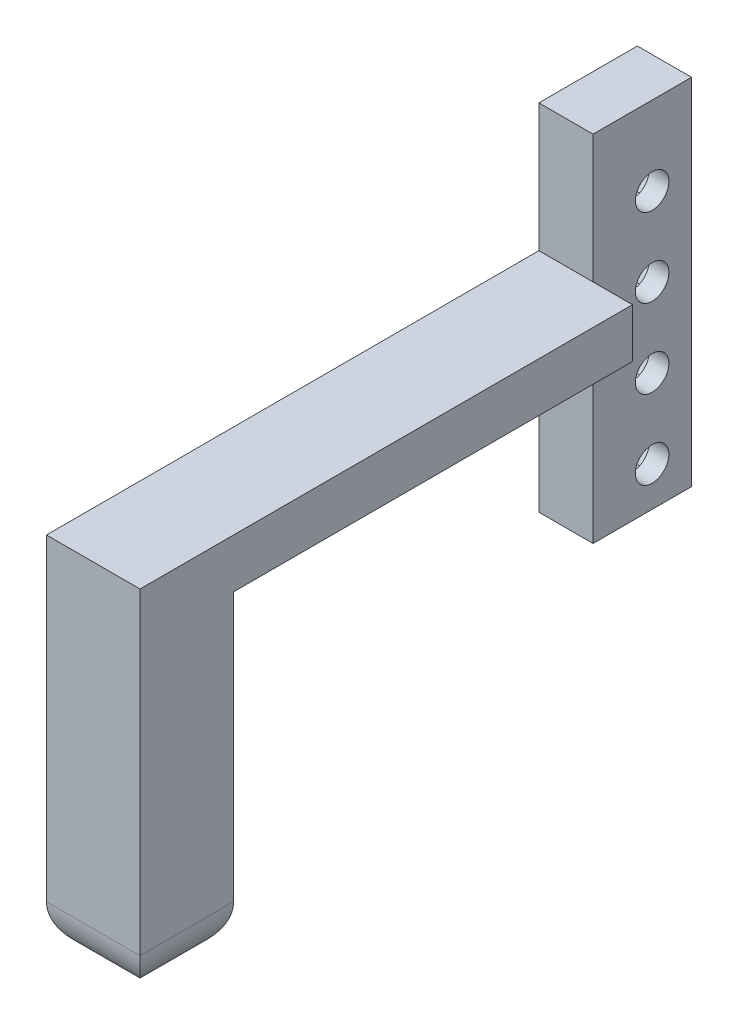
from build123d import *

# Parameters (mm, degrees)
ESQUISSE1_W                       = 5.5
ESQUISSE1_H                       = 36
BOSS_EXTRU_1_DEPTH                = 10
ESQUISSE2_R                       = 1.7
ENL_V_MAT_EXTRU_1_DEPTH           = 4
ENL_V_MAT_EXTRU_2_DEPTH           = 3.5
ENL_V_MAT_EXTRU_2_DRAFT           = 5
ENL_V_MAT_EXTRU_2_PROFILE_2_DEPTH = 3.5
ENL_V_MAT_EXTRU_2_PROFILE_2_DRAFT = 5
ENL_V_MAT_EXTRU_2_PROFILE_3_DEPTH = 3.5
ENL_V_MAT_EXTRU_2_PROFILE_3_DRAFT = 5
ENL_V_MAT_EXTRU_2_PROFILE_4_DEPTH = 3.5
ENL_V_MAT_EXTRU_2_PROFILE_4_DRAFT = 5
ESQUISSE4_W                       = 9.5
ESQUISSE4_H                       = 5
BOSS_EXTRU_2_DEPTH                = 50
ESQUISSE5_W                       = 9.5
ESQUISSE5_H                       = 9.5
BOSS_EXTRU_3_DEPTH                = 32
CONG_1_R                          = 4.75


with BuildPart() as part:
    # Esquisse1 → Boss.-Extru.1 (new body)
    with BuildSketch(Plane.XY):
        Rectangle(ESQUISSE1_W, ESQUISSE1_H)
    extrude(amount=BOSS_EXTRU_1_DEPTH)

    # Esquisse2 → Enlèv. mat.-Extru.1 (cut)
    with BuildSketch(Plane(origin=(2.75, 0, 0), x_dir=(0, 0, -1), z_dir=(1, 0, 0))):
        with Locations((-4, 10)):
            Circle(ESQUISSE2_R)
        with Locations((-4, 2)):
            Circle(ESQUISSE2_R)
        with Locations((-4, -6)):
            Circle(ESQUISSE2_R)
        with Locations((-4, -14)):
            Circle(ESQUISSE2_R)
    extrude(amount=-ENL_V_MAT_EXTRU_1_DEPTH, mode=Mode.SUBTRACT)


with BuildPart() as enl_v_mat_extru_2_tool:
    # Esquisse3 → Enlèv. mat.-Extru.2 (with draft: the straight prism first)
    with BuildSketch(Plane(origin=(-2.75, 0, 0), x_dir=(0, 0, -1), z_dir=(1, 0, 0))):
        Polygon((-2.574135551, 4.901765653), (-5.800070547, 4.685717662), (-7.225934996, 1.783952009), (-5.425864449, -0.901765653), (-2.199929453, -0.685717662), (-0.774065004, 2.216047991), align=None)
    extrude(amount=ENL_V_MAT_EXTRU_2_DEPTH)
    # Enlèv. mat.-Extru.2: the draft: its side faces are tilted about the plane it starts from
    enl_v_mat_extru_2_sides = [enl_v_mat_extru_2_tool.faces().sort_by_distance(p)[0] for p in [
        (-1, 4.793741658, 4.187103049),
        (-1, 3.234834835, 6.513002771),
        (-1, 0.441093178, 6.325899723),
        (-1, -0.793741658, 3.812896951),
        (-1, 0.765165165, 1.486997229),
        (-1, 3.558906822, 1.674100277),
    ]]
    draft(enl_v_mat_extru_2_sides, Plane(origin=(-2.75, 0, 0), x_dir=(0, 0, -1), z_dir=(1, 0, 0)), ENL_V_MAT_EXTRU_2_DRAFT)


with BuildPart() as part_1:
    add(part.part)

    # Enlèv. mat.-Extru.2: cut by enl_v_mat_extru_2_tool
    add(enl_v_mat_extru_2_tool.part, mode=Mode.SUBTRACT)


with BuildPart() as enl_v_mat_extru_2_profile_2_tool:
    # Esquisse3 → Enlèv. mat.-Extru.2 profile 2 (with draft: the straight prism first)
    with BuildSketch(Plane(origin=(-2.75, 0, 0), x_dir=(0, 0, -1), z_dir=(1, 0, 0))):
        Polygon((-2.574135551, 12.901765653), (-5.800070547, 12.685717662), (-7.225934996, 9.783952009), (-5.425864449, 7.098234347), (-2.199929453, 7.314282338), (-0.774065004, 10.216047991), align=None)
    extrude(amount=ENL_V_MAT_EXTRU_2_PROFILE_2_DEPTH)
    # Enlèv. mat.-Extru.2 profile 2: the draft: its side faces are tilted about the plane it starts from
    enl_v_mat_extru_2_profile_2_sides = [enl_v_mat_extru_2_profile_2_tool.faces().sort_by_distance(p)[0] for p in [
        (-1, 12.793741658, 4.187103049),
        (-1, 11.234834835, 6.513002771),
        (-1, 8.441093178, 6.325899723),
        (-1, 7.206258342, 3.812896951),
        (-1, 8.765165165, 1.486997229),
        (-1, 11.558906822, 1.674100277),
    ]]
    draft(enl_v_mat_extru_2_profile_2_sides, Plane(origin=(-2.75, 0, 0), x_dir=(0, 0, -1), z_dir=(1, 0, 0)), ENL_V_MAT_EXTRU_2_PROFILE_2_DRAFT)


with BuildPart() as part_2:
    add(part_1.part)

    # Enlèv. mat.-Extru.2 profile 2: cut by enl_v_mat_extru_2_profile_2_tool
    add(enl_v_mat_extru_2_profile_2_tool.part, mode=Mode.SUBTRACT)


with BuildPart() as enl_v_mat_extru_2_profile_3_tool:
    # Esquisse3 → Enlèv. mat.-Extru.2 profile 3 (with draft: the straight prism first)
    with BuildSketch(Plane(origin=(-2.75, 0, 0), x_dir=(0, 0, -1), z_dir=(1, 0, 0))):
        Polygon((-2.574135551, -3.098234347), (-5.800070547, -3.314282338), (-7.225934996, -6.216047991), (-5.425864449, -8.901765653), (-2.199929453, -8.685717662), (-0.774065004, -5.783952009), align=None)
    extrude(amount=ENL_V_MAT_EXTRU_2_PROFILE_3_DEPTH)
    # Enlèv. mat.-Extru.2 profile 3: the draft: its side faces are tilted about the plane it starts from
    enl_v_mat_extru_2_profile_3_sides = [enl_v_mat_extru_2_profile_3_tool.faces().sort_by_distance(p)[0] for p in [
        (-1, -3.206258342, 4.187103049),
        (-1, -4.765165165, 6.513002771),
        (-1, -7.558906822, 6.325899723),
        (-1, -8.793741658, 3.812896951),
        (-1, -7.234834835, 1.486997229),
        (-1, -4.441093178, 1.674100277),
    ]]
    draft(enl_v_mat_extru_2_profile_3_sides, Plane(origin=(-2.75, 0, 0), x_dir=(0, 0, -1), z_dir=(1, 0, 0)), ENL_V_MAT_EXTRU_2_PROFILE_3_DRAFT)


with BuildPart() as part_3:
    add(part_2.part)

    # Enlèv. mat.-Extru.2 profile 3: cut by enl_v_mat_extru_2_profile_3_tool
    add(enl_v_mat_extru_2_profile_3_tool.part, mode=Mode.SUBTRACT)


with BuildPart() as enl_v_mat_extru_2_profile_4_tool:
    # Esquisse3 → Enlèv. mat.-Extru.2 profile 4 (with draft: the straight prism first)
    with BuildSketch(Plane(origin=(-2.75, 0, 0), x_dir=(0, 0, -1), z_dir=(1, 0, 0))):
        Polygon((-2.574135551, -11.098234347), (-5.800070547, -11.314282338), (-7.225934996, -14.216047991), (-5.425864449, -16.901765653), (-2.199929453, -16.685717662), (-0.774065004, -13.783952009), align=None)
    extrude(amount=ENL_V_MAT_EXTRU_2_PROFILE_4_DEPTH)
    # Enlèv. mat.-Extru.2 profile 4: the draft: its side faces are tilted about the plane it starts from
    enl_v_mat_extru_2_profile_4_sides = [enl_v_mat_extru_2_profile_4_tool.faces().sort_by_distance(p)[0] for p in [
        (-1, -11.206258342, 4.187103049),
        (-1, -12.765165165, 6.513002771),
        (-1, -15.558906822, 6.325899723),
        (-1, -16.793741658, 3.812896951),
        (-1, -15.234834835, 1.486997229),
        (-1, -12.441093178, 1.674100277),
    ]]
    draft(enl_v_mat_extru_2_profile_4_sides, Plane(origin=(-2.75, 0, 0), x_dir=(0, 0, -1), z_dir=(1, 0, 0)), ENL_V_MAT_EXTRU_2_PROFILE_4_DRAFT)


with BuildPart() as part_4:
    add(part_3.part)

    # Enlèv. mat.-Extru.2 profile 4: cut by enl_v_mat_extru_2_profile_4_tool
    add(enl_v_mat_extru_2_profile_4_tool.part, mode=Mode.SUBTRACT)

    # Esquisse4 → Boss.-Extru.2 (add)
    with BuildSketch(Plane.XY.offset(10)):
        with Locations((2, 2.5)):
            Rectangle(ESQUISSE4_W, ESQUISSE4_H)
    extrude(amount=BOSS_EXTRU_2_DEPTH)

    # Esquisse5 → Boss.-Extru.3 (add)
    with BuildSketch(Plane.XZ):
        with Locations((2, 55.25)):
            Rectangle(ESQUISSE5_W, ESQUISSE5_H)
    extrude(amount=BOSS_EXTRU_3_DEPTH)

    # Congé1
    cong_1_edges = [part_4.edges().sort_by_distance(p)[0] for p in [
        (-2.75, -32, 55.25),
        (2, -32, 50.5),
        (6.75, -32, 55.25),
        (2, -32, 60),
    ]]
    fillet(cong_1_edges, radius=CONG_1_R - 0.0001)  # a hair under: the kernel refuses the full size


solid = part_4.part
